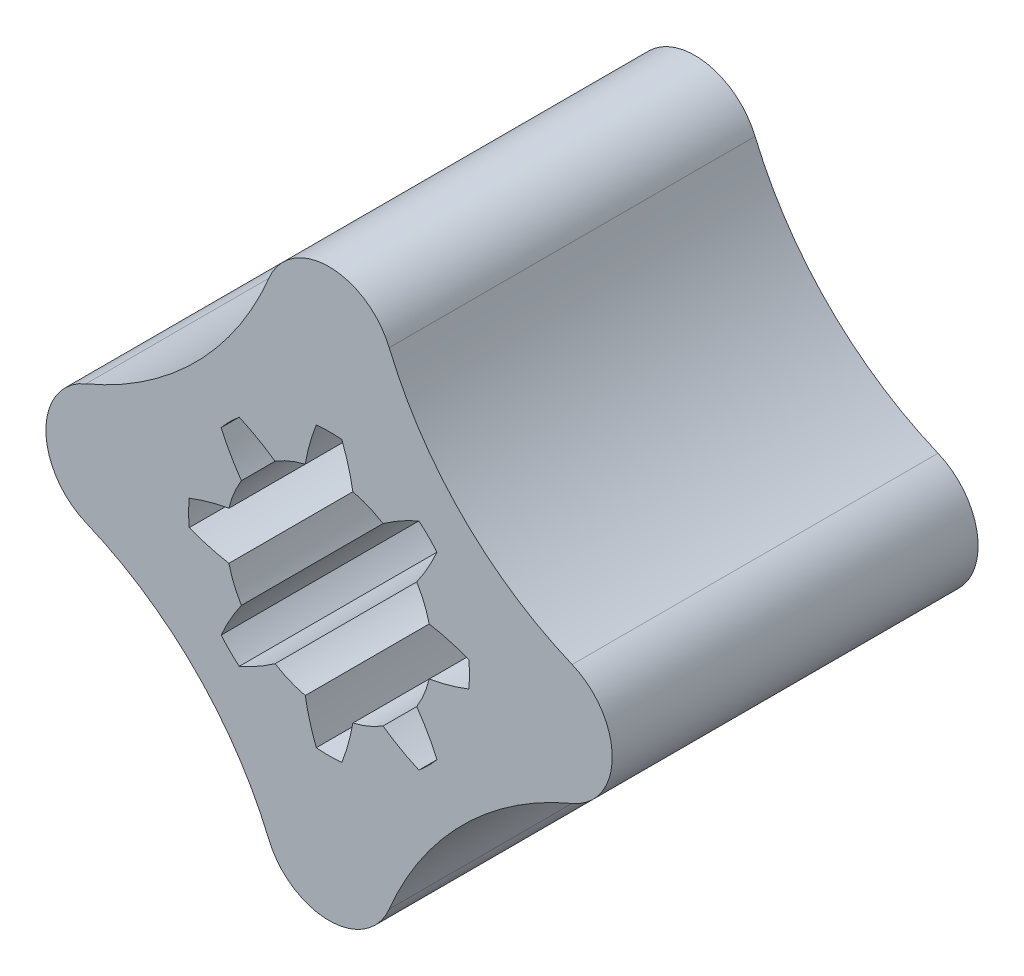
from build123d import *
from build123d.topology import SkipClean

# Parameters (mm, degrees)
SKETCH1_R         = 6
EXTRUDE1_DEPTH    = 21.5
EXTRUDE2_REACH    = 33.875
CIRPATTERN1_COUNT = 8


with BuildPart() as part:
    # Sketch1 → Extrude1 (new body)
    with BuildSketch(Plane.XY):
        with BuildLine():
            ThreePointArc((3.535156209, 14.285110262), (0, 16.64), (-3.535156209, 14.285110262))
            ThreePointArc((-3.535156209, 14.285110262), (-7.848885271, 7.848885271), (-14.285110262, 3.535156209))
            ThreePointArc((-14.285110262, 3.535156209), (-16.64, 0), (-14.285110262, -3.535156209))
            ThreePointArc((-14.285110262, -3.535156209), (-7.848885271, -7.848885271), (-3.535156209, -14.285110262))
            ThreePointArc((-3.535156209, -14.285110262), (0, -16.64), (3.535156209, -14.285110262))
            ThreePointArc((3.535156209, -14.285110262), (7.848885271, -7.848885271), (14.285110262, -3.535156209))
            ThreePointArc((14.285110262, -3.535156209), (16.64, 0), (14.285110262, 3.535156209))
            ThreePointArc((14.285110262, 3.535156209), (7.848885271, 7.848885271), (3.535156209, 14.285110262))
        make_face()
        Circle(SKETCH1_R, mode=Mode.SUBTRACT)
    extrude(amount=EXTRUDE1_DEPTH)

    # Sketch4 → Cut-Revolve1 (revolve, cut)
    with BuildSketch(Plane(origin=(0, 0, 0), x_dir=(0, 0, -1), z_dir=(1, 0, 0))):
        Polygon((0, 0), (-21.5, 0), (-21.5, 6.05), (-7.2, 6.05), (-5, 8.25), (0, 8.25), align=None)
    revolve(axis=Axis((0, 0, 0), (0, 0, 1)), mode=Mode.SUBTRACT)

    # Sketch2 → Extrude2 (cut, up to next)
    with BuildSketch(Plane(origin=(0, 0, 0), x_dir=(-1, 0, 0), z_dir=(0, 0, -1)), mode=Mode.PRIVATE) as extrude2_sk1:
        with BuildLine():
            ThreePointArc((0.75, 8.215838363), (0, 8.25), (-0.75, 8.215838363))
            ThreePointArc((-0.75, 8.215838363), (-1.133672744, 7.067180744), (-1.4, 5.885787968))
            ThreePointArc((-1.4, 5.885787968), (0, 6.05), (1.4, 5.885787968))
            ThreePointArc((1.4, 5.885787968), (1.133672744, 7.067180744), (0.75, 8.215838363))
        make_face()
    extrude2_tool1 = extrude(extrude2_sk1.sketch, amount=-EXTRUDE2_REACH, mode=Mode.PRIVATE) & part.part
    extrude2 = extrude2_tool1.solids().sort_by_distance((0, 7.008505, 0))[0]
    add(extrude2, mode=Mode.SUBTRACT)

    # CirPattern1: Extrude2 ×8 about axis
    with SkipClean():  # the faces are left unmerged after this step: merging them gives an invalid solid
        cirpattern1_axis = Axis((0, 0, 0), (0, 0, -1))
        for i in range(1, CIRPATTERN1_COUNT):
            add(extrude2.rotate(cirpattern1_axis, i * 360 / CIRPATTERN1_COUNT), mode=Mode.SUBTRACT)


solid = part.part
